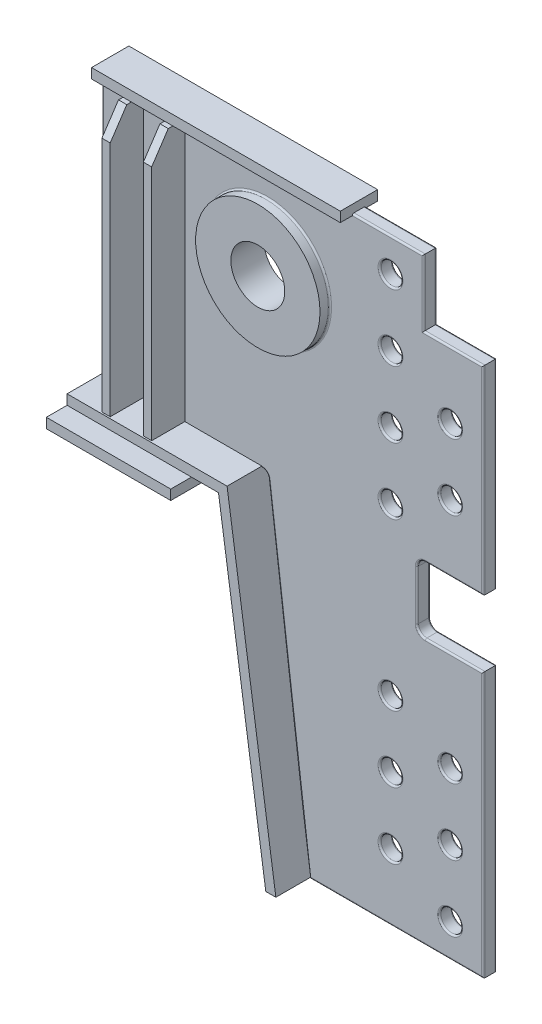
from build123d import *

# Parameters (mm, degrees)
SKETCH_1_R           = 13
SKETCH_1_R_2         = 37.5
EXTRUDE_1319_DEPTH   = 16
EXTRUDE_1_DEPTH      = 12
EXTRUDE_1_DEPTH_BACK = 28
SKETCH_2_R           = 75
SKETCH_2_R_2         = 32.5
FILLET_1_R           = 2
FILLET_2_R           = 2
EXTRUDE_2_DEPTH      = 40
EXTRUDE_2_DEPTH_BACK = 56
SKETCH_3_W           = 10
SKETCH_3_H           = 316
CUT_EXTRUDE_1_DEPTH  = 836.425640018
CUT_EXTRUDE_2_DEPTH  = 836.425640018
EXTRUDE_5_DEPTH      = 42
EXTRUDE_5_DEPTH_BACK = 58
EXTRUDE_6_DEPTH      = 14.5
EXTRUDE_6_DEPTH_BACK = 30.5
SKETCH_7_W           = 300
SKETCH_7_H           = 12
SKETCH_8_W           = 150
SKETCH_8_H           = 150
EXTRUDE_7_DEPTH      = 12


with BuildPart() as part:
    # 草图1 → Extrude 1319 (new body)
    with BuildSketch(Plane.XY):
        with BuildLine():
            Line((0, -320), (-70, -320))
            ThreePointArc((-70, -320), (-77.071067812, -322.928932188), (-80, -330))
            Line((-80, -330), (-80, -390))
            ThreePointArc((-80, -390), (-77.071067812, -397.071067812), (-70, -400))
            Line((-70, -400), (0, -400))
            Line((0, -400), (0, -720))
            Line((0, -720), (-210, -720))
            Line((-210, -720), (-259.124034735, -327.007722123))
            ThreePointArc((-259.124034735, -327.007722123), (-261.767837242, -322.002574593), (-267.062257748, -320))
            Line((-267.062257748, -320), (-460, -320))
            Line((-460, -320), (-460, 0))
            Line((-460, 0), (-72, 0))
            Line((-72, 0), (-72, -80))
            Line((-72, -80), (0, -80))
            Line((0, -80), (0, -320))
        make_face()
        with Locations((-112, -40)):
            Circle(SKETCH_1_R, mode=Mode.SUBTRACT)
        with Locations((-112, -120)):
            Circle(SKETCH_1_R, mode=Mode.SUBTRACT)
        with Locations((-112, -200)):
            Circle(SKETCH_1_R, mode=Mode.SUBTRACT)
        with Locations((-112, -280)):
            Circle(SKETCH_1_R, mode=Mode.SUBTRACT)
        with Locations((-40, -160)):
            Circle(SKETCH_1_R, mode=Mode.SUBTRACT)
        with Locations((-40, -240)):
            Circle(SKETCH_1_R, mode=Mode.SUBTRACT)
        with Locations((-40, -680)):
            Circle(SKETCH_1_R, mode=Mode.SUBTRACT)
        with Locations((-40, -600)):
            Circle(SKETCH_1_R, mode=Mode.SUBTRACT)
        with Locations((-40, -520)):
            Circle(SKETCH_1_R, mode=Mode.SUBTRACT)
        with Locations((-112, -640)):
            Circle(SKETCH_1_R, mode=Mode.SUBTRACT)
        with Locations((-112, -560)):
            Circle(SKETCH_1_R, mode=Mode.SUBTRACT)
        with Locations((-112, -480)):
            Circle(SKETCH_1_R, mode=Mode.SUBTRACT)
        with Locations((-260, -110)):
            Circle(SKETCH_1_R_2, mode=Mode.SUBTRACT)
    extrude(amount=EXTRUDE_1319_DEPTH)

    # 草图2 → 凸台-拉伸1 (add, two sides: drawn at the far end of the back side and taken through both)
    with BuildSketch(Plane.XY.offset(16).offset(-EXTRUDE_1_DEPTH_BACK)):
        with Locations((-260, -110)):
            Circle(SKETCH_2_R)
        with Locations((-260, -110)):
            Circle(SKETCH_2_R_2, mode=Mode.SUBTRACT)
    extrude(amount=EXTRUDE_1_DEPTH + EXTRUDE_1_DEPTH_BACK)

    # 圆角1
    fillet_1_edges = [part.edges().sort_by_distance(p)[0] for p in [
        (-335, -110, 16),
        (-125, -560, 16),
        (-53, -600, 16),
        (-53, -240, 16),
        (-35, -320, 16),
        (-77.071067812, -322.928932188, 16),
        (-80, -360, 16),
        (-77.071067812, -397.071067812, 16),
        (-35, -400, 16),
        (0, -560, 16),
        (-105, -720, 16),
        (-234.562017367, -523.503861062, 16),
        (-261.767837242, -322.002574593, 16),
        (-363.531128874, -320, 16),
        (-460, -160, 16),
        (-266, 0, 16),
        (-53, -680, 16),
        (-53, -520, 16),
        (-125, -480, 16),
        (-125, -640, 16),
        (-125, -280, 16),
        (-125, -120, 16),
        (-72, -40, 16),
        (-36, -80, 16),
        (0, -200, 16),
        (-125, -40, 16),
        (-125, -200, 16),
        (-53, -160, 16),
    ]]
    fillet(fillet_1_edges, radius=FILLET_1_R)

    # 圆角2
    fillet_2_edges = [part.edges().sort_by_distance(p)[0] for p in [
        (-335, -110, 0),
        (-125, -560, 0),
        (-53, -600, 0),
        (-53, -240, 0),
        (-266, 0, 0),
        (-460, -160, 0),
        (-363.531128874, -320, 0),
        (-261.767837242, -322.002574593, 0),
        (-234.562017367, -523.503861062, 0),
        (-105, -720, 0),
        (0, -560, 0),
        (-35, -400, 0),
        (-77.071067812, -397.071067812, 0),
        (-80, -360, 0),
        (-77.071067812, -322.928932188, 0),
        (-35, -320, 0),
        (-53, -680, 0),
        (-53, -520, 0),
        (-125, -480, 0),
        (-125, -640, 0),
        (-125, -280, 0),
        (-125, -120, 0),
        (0, -200, 0),
        (-36, -80, 0),
        (-72, -40, 0),
        (-125, -40, 0),
        (-125, -200, 0),
        (-53, -160, 0),
    ]]
    fillet(fillet_2_edges, radius=FILLET_2_R)

    # 草图3 → 凸台-拉伸2 (add, two sides: drawn at the far end of the back side and taken through both)
    with BuildSketch(Plane.XY.offset(16).offset(-EXTRUDE_2_DEPTH_BACK)):
        with Locations((-415, -160)):
            Rectangle(SKETCH_3_W, SKETCH_3_H)
        with Locations((-365, -160)):
            Rectangle(SKETCH_3_W, SKETCH_3_H)
    extrude(amount=EXTRUDE_2_DEPTH + EXTRUDE_2_DEPTH_BACK)

    # 草图4 → 切除-拉伸1 (cut, through all)
    with BuildSketch(Plane.ZY.offset(420)):
        Polygon((-20, -2), (-45.5, -32), (-45.5, -2), align=None)
    extrude(amount=-CUT_EXTRUDE_1_DEPTH, mode=Mode.SUBTRACT)

    # 草图5 → 切除-拉伸2 (cut, through all)
    with BuildSketch(Plane.ZY.offset(420)):
        Polygon((36, -2), (56, -32), (56, -2), align=None)
    extrude(amount=-CUT_EXTRUDE_2_DEPTH, mode=Mode.SUBTRACT)

    # 草图6 → 凸台-拉伸5 (add, two sides: drawn at the far end of the back side and taken through both)
    with BuildSketch(Plane.XY.offset(16).offset(-EXTRUDE_5_DEPTH_BACK)):
        Polygon((-267.062257748, -318), (-460, -318), (-460, -330), (-277.426505546, -330), (-220.363518026, -718), (-208.234435563, -718), align=None)
    extrude(amount=EXTRUDE_5_DEPTH + EXTRUDE_5_DEPTH_BACK)

    # 草图7 → 凸台-拉伸6 (add, two sides: drawn at the far end of the back side and taken through both)
    with BuildSketch(Plane(origin=(0, 0, 0), x_dir=(-1, 0, 0), z_dir=(0, 0, -1)).offset(-EXTRUDE_6_DEPTH_BACK)):
        with Locations((308, 4)):
            Rectangle(SKETCH_7_W, SKETCH_7_H)
    extrude(amount=EXTRUDE_6_DEPTH + EXTRUDE_6_DEPTH_BACK)

    # 草图8 → 凸台-拉伸7 (add)
    with BuildSketch(Plane.XZ.offset(330)):
        with Locations((-385, 8)):
            Rectangle(SKETCH_8_W, SKETCH_8_H)
    extrude(amount=EXTRUDE_7_DEPTH)


solid = part.part
